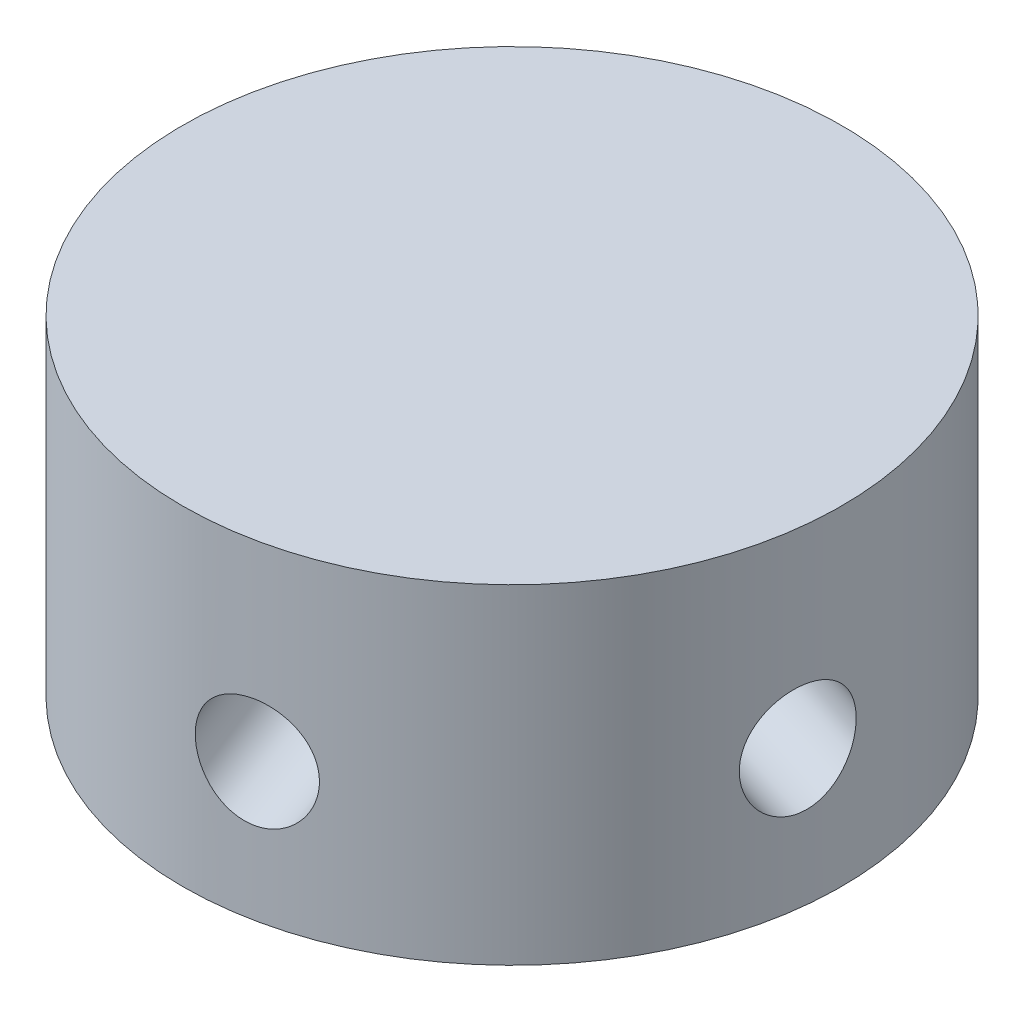
from build123d import *

# Parameters (mm, degrees)
BOSS_EXTRUDE1_DEPTH      = 3
BOSS_EXTRUDE1_DEPTH_BACK = 7
SKETCH1_R                = 10
SKETCH4_R                = 1.6
HOLE_DEPTH               = 19.828402711
HOLECIR_COUNT            = 5


with BuildPart() as part:
    # Sketch1 → Boss-Extrude1 (new, two sides: drawn at the far end of the back side and taken through both)
    with BuildSketch(Plane(origin=(0, 0, 0), x_dir=(1, 0, 0), z_dir=(0, 1, 0)).offset(-BOSS_EXTRUDE1_DEPTH_BACK)):
        Circle(SKETCH1_R)
    extrude(amount=BOSS_EXTRUDE1_DEPTH + BOSS_EXTRUDE1_DEPTH_BACK)

    # Sketch4 → hole (cut, through all)
    with BuildSketch(Plane(origin=(-3.352872105, -1.093066116, 1.887711608), x_dir=(-0.4486862613641547, -0.14627571033740308, -0.8816371449912632), z_dir=(0.8382180262940947, 0.2732665289126682, -0.47192790187872385))):
        Circle(SKETCH4_R)
    hole = extrude(amount=-HOLE_DEPTH, mode=Mode.SUBTRACT)

    # holecir: hole ×5 about axis
    holecir_axis = Axis((0, 5.5, 0), (0, -1, 0))
    for i in range(1, HOLECIR_COUNT):
        add(hole.rotate(holecir_axis, i * 360 / HOLECIR_COUNT), mode=Mode.SUBTRACT)


solid = part.part
